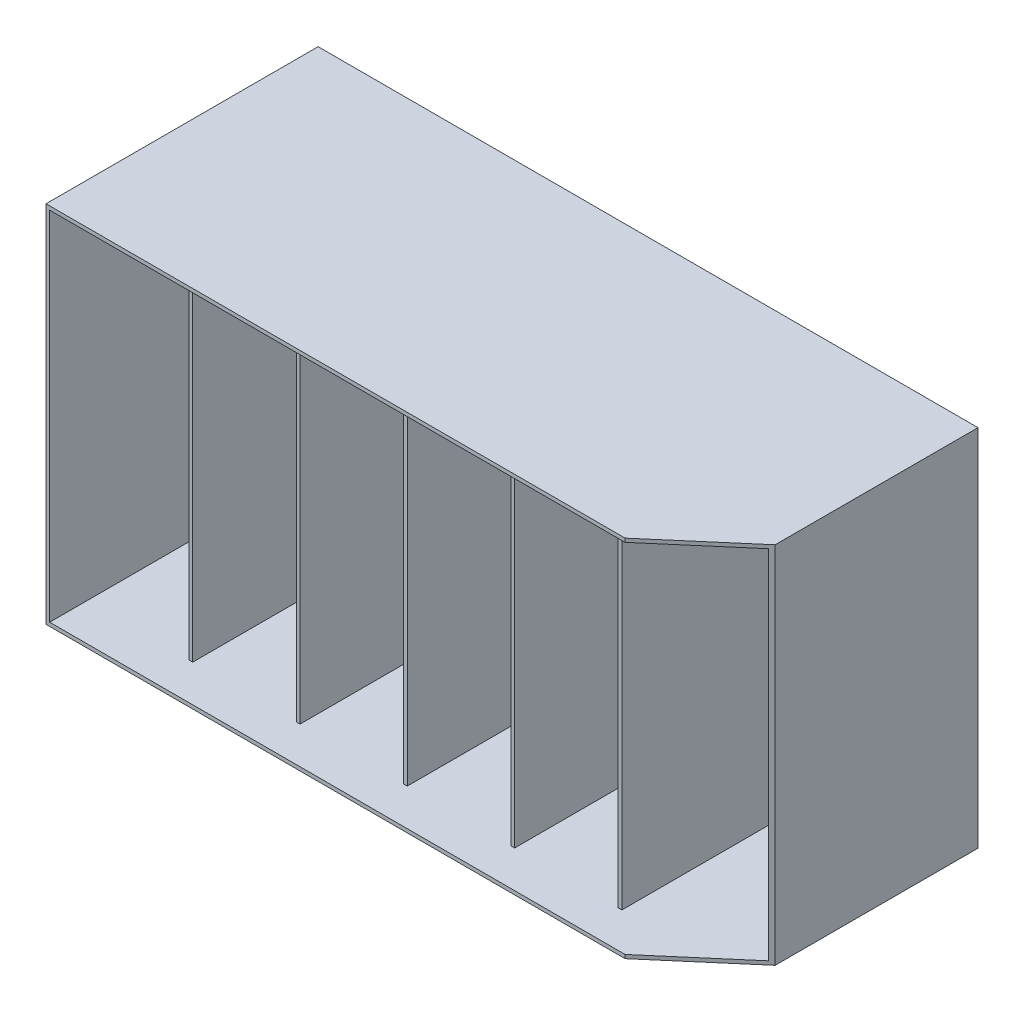
from build123d import *

# Parameters (mm, degrees)
SKETCH1_W           = 571.754
SKETCH1_H           = 315.575
BOSS_EXTRUDE1_DEPTH = 3.175
SKETCH2_W           = 571.754
SKETCH2_H           = 315.575
SKETCH2_W_2         = 101.598
SKETCH2_H_2         = 309.225
SKETCH2_W_3         = 89.789
SKETCH2_W_4         = 88.775
BOSS_EXTRUDE2_DEPTH = 200.6
SKETCH3_W           = 571.754
SKETCH3_H           = 315.575
BOSS_EXTRUDE3_DEPTH = 32
CUT_EXTRUDE1_DEPTH  = 487.72691561


with BuildPart() as part:
    # Sketch1 → Boss-Extrude1 (new body)
    with BuildSketch(Plane.XY):
        Rectangle(SKETCH1_W, SKETCH1_H)
    extrude(amount=BOSS_EXTRUDE1_DEPTH)

    # Sketch2 → Boss-Extrude2 (add)
    with BuildSketch(Plane.XY.offset(3.175)):
        Rectangle(SKETCH2_W, SKETCH2_H)
        with Locations((231.903, 0)):
            Rectangle(SKETCH2_W_2, SKETCH2_H_2, mode=Mode.SUBTRACT)
        with Locations((133.0345, 0)):
            Rectangle(SKETCH2_W_3, SKETCH2_H_2, mode=Mode.SUBTRACT)
        with Locations((40.0705, 0)):
            Rectangle(SKETCH2_W_3, SKETCH2_H_2, mode=Mode.SUBTRACT)
        with Locations((-52.8935, 0)):
            Rectangle(SKETCH2_W_3, SKETCH2_H_2, mode=Mode.SUBTRACT)
        with Locations((-145.8575, 0)):
            Rectangle(SKETCH2_W_3, SKETCH2_H_2, mode=Mode.SUBTRACT)
        with Locations((-238.3145, 0)):
            Rectangle(SKETCH2_W_4, SKETCH2_H_2, mode=Mode.SUBTRACT)
    extrude(amount=BOSS_EXTRUDE2_DEPTH)

    # Sketch3 → Boss-Extrude3 (add)
    with BuildSketch(Plane.XY.offset(203.775)):
        Rectangle(SKETCH3_W, SKETCH3_H)
        Polygon((181.104, 154.6125), (282.702, 154.6125), (282.702, -154.6125), (181.104, -154.6125), (177.929, -154.6125), (88.14, -154.6125), (84.965, -154.6125), (-4.824, -154.6125), (-7.999, -154.6125), (-97.788, -154.6125), (-100.963, -154.6125), (-190.752, -154.6125), (-193.927, -154.6125), (-282.702, -154.6125), (-282.702, 154.6125), (-193.927, 154.6125), (-190.752, 154.6125), (-100.963, 154.6125), (-97.788, 154.6125), (-7.999, 154.6125), (-4.824, 154.6125), (84.965, 154.6125), (88.14, 154.6125), (177.929, 154.6125), align=None, mode=Mode.SUBTRACT)
    extrude(amount=BOSS_EXTRUDE3_DEPTH)

    # Sketch4 → Cut-Extrude1 (cut, through all)
    with BuildSketch(Plane.XZ.offset(157.7875)):
        Polygon((285.877, 235.775), (215.877, 235.775), (285.877, 175.775), align=None)
    extrude(amount=-CUT_EXTRUDE1_DEPTH, mode=Mode.SUBTRACT)


solid = part.part
